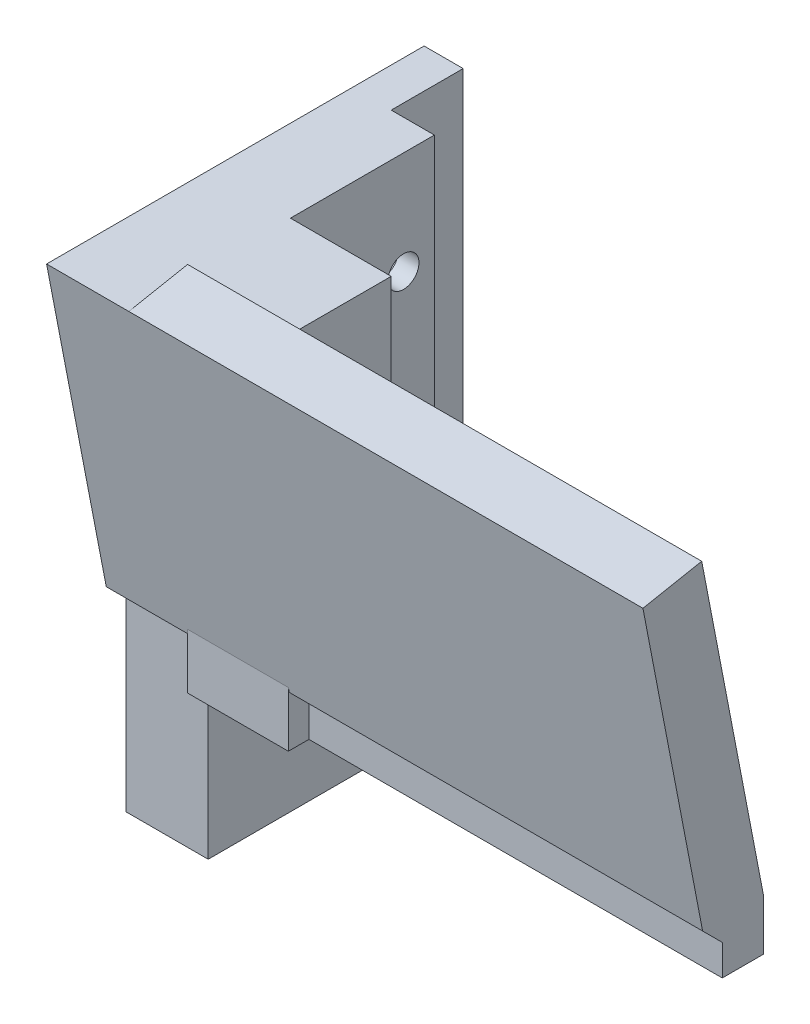
from build123d import *

# Parameters (mm, degrees)
EXTRUDE_1_DEPTH      = 50
SKETCH_2_W           = 50
SKETCH_2_H           = 10
EXTRUDE_2_DEPTH      = 10
SKETCH_3_W           = 10
SKETCH_3_H           = 20
EXTRUDE_3_DEPTH      = 20
SKETCH_4_W           = 20
SKETCH_4_H           = 10
EXTRUDE_4_DEPTH      = 30
CUT_EXTRUDE_1_DEPTH  = 50
CHAMFER_1_SIZE       = 2
SKETCH_9_R           = 1.5
CUT_EXTRUDE_2_DEPTH  = 66.493778942
CUT_EXTRUDE_4_DEPTH  = 6
SKETCH_13_W          = 4
SKETCH_13_H          = 6
EXTRUDE_12_DEPTH     = 18
SKETCH_14_W          = 20
SKETCH_14_H          = 20
EXTRUDE_13_DEPTH     = 6
CUT_EXTRUDE_START    = -20
SKETCH_15_W          = 50
SKETCH_15_H          = 6
CUT_EXTRUDE_5_DEPTH  = 20
SKETCH_16_W          = 4
SKETCH_16_H          = 4
CUT_EXTRUDE_7_DEPTH  = 18
EXTRUDE_14_REACH     = 68.163
SKETCH_17_W          = 5
SKETCH_17_H          = 30
SKETCH_18_W          = 50
SKETCH_18_H          = 4
EXTRUDE_15_DEPTH     = 18
CUT_EXTRUDE_8_REACH  = 67.494
SKETCH_19_W          = 60
SKETCH_19_H          = 10
SKETCH_20_R          = 1.5
CUT_EXTRUDE_9_DEPTH  = 4
CHAMFER_2_SIZE       = 2
SKETCH_21_W          = 15
SKETCH_21_H          = 50
CUT_EXTRUDE_10_DEPTH = 10
SKETCH_22_W          = 5
SKETCH_22_H          = 50
EXTRUDE_16_DEPTH     = 19
SKETCH_23_W          = 7
SKETCH_23_H          = 50
CUT_EXTRUDE_11_DEPTH = 4.2
EXTRUDE_17_DEPTH     = 3
SKETCH_25_R          = 1.5
CUT_EXTRUDE_12_DEPTH = 8
SKETCH_26_R          = 2.9
CUT_EXTRUDE_13_DEPTH = 6
CUT_EXTRUDE_14_REACH = 67.988
SKETCH_27_W          = 4
SKETCH_27_H          = 10
SKETCH_29_W          = 8
SKETCH_29_H          = 10
EXTRUDE_18_DEPTH     = 6
SKETCH_30_W          = 50
SKETCH_30_H          = 5
CUT_EXTRUDE_15_DEPTH = 4
EXTRUDE_19_REACH     = 75.219
SKETCH_31_W          = 9.8
SKETCH_31_H          = 10


with BuildPart() as part:
    # 草图1 → 凸台-拉伸1 (new body)
    with BuildSketch(Plane(origin=(0, 0, 0), x_dir=(0, 0, -1), z_dir=(1, 0, 0))):
        Polygon((0, 0), (-10, 0), (-17.716362436, 40), (-12, 41.102738109), (-6, 10), (0, 10), align=None)
    extrude(amount=EXTRUDE_1_DEPTH)

    # 草图2 → 凸台-拉伸2 (add)
    with BuildSketch(Plane.XZ):
        with Locations((25, 5)):
            Rectangle(SKETCH_2_W, SKETCH_2_H)
    extrude(amount=EXTRUDE_2_DEPTH)

    # 草图3 → 凸台-拉伸3 (add)
    with BuildSketch(Plane.ZY):
        with Locations((5, 0)):
            Rectangle(SKETCH_3_W, SKETCH_3_H)
    extrude(amount=EXTRUDE_3_DEPTH)

    # 草图4 → 凸台-拉伸4 (add)
    with BuildSketch(Plane(origin=(0, 10, 0), x_dir=(1, 0, 0), z_dir=(0, 1, 0))):
        with Locations((-10, -5)):
            Rectangle(SKETCH_4_W, SKETCH_4_H)
    extrude(amount=EXTRUDE_4_DEPTH)

    # 草图5 → 切除-拉伸1 (cut)
    with BuildSketch(Plane(origin=(50, 0, 0), x_dir=(0, 0, -1), z_dir=(1, 0, 0))):
        Polygon((-10, 10), (-11.929090609, 10), (-10, 0), align=None)
    extrude(amount=-CUT_EXTRUDE_1_DEPTH, mode=Mode.SUBTRACT)

    # 倒角1
    # the kernel refuses this chamfer: 2 mm, written as the material it adds along each edge
    with BuildSketch(Plane(origin=(50, 10, 10), x_dir=(0, 0.027495876610586487, 0.9996219169112968), z_dir=(-1, 0, 0))) as chamfer_1_piece_1_section:
        Polygon((CHAMFER_1_SIZE * 0.999621916911, -CHAMFER_1_SIZE * 0.0274958766106), (-CHAMFER_1_SIZE * 0.0274958766106, -CHAMFER_1_SIZE * 0.999621916911), (0, 0), align=None)
    chamfer_1_piece_1 = extrude(amount=50, mode=Mode.PRIVATE)
    chamfer_1_piece_1 = split(chamfer_1_piece_1, bisect_by=Plane(origin=(25, 9.122791872, 11.759869213), z_dir=(0, 0.18941678522713282, -0.9818967774029093)), keep=Keep.TOP, mode=Mode.PRIVATE)
    add(chamfer_1_piece_1)

    # 草图9 → 切除-拉伸2 (cut, through all)
    with BuildSketch(Plane.XY.offset(10)):
        with Locations((-10, 30)):
            Circle(SKETCH_9_R)
        with Locations((30, 0)):
            Circle(SKETCH_9_R)
    extrude(amount=-CUT_EXTRUDE_2_DEPTH, mode=Mode.SUBTRACT)

    # 草图12 → 切除-拉伸4 (cut)
    with BuildSketch(Plane.XY.offset(10)):
        Polygon((0, 30.73515874), (0, 40), (-20, 40), (-20, -10), (50, -10), (50, 8), (0, 8), align=None)
    extrude(amount=-CUT_EXTRUDE_4_DEPTH, mode=Mode.SUBTRACT)

    # 草图13 → 凸台-拉伸12 (add)
    with BuildSketch(Plane.XZ.offset(-8)):
        with Locations((2, 7)):
            Rectangle(SKETCH_13_W, SKETCH_13_H)
        with Locations((48, 7)):
            Rectangle(SKETCH_13_W, SKETCH_13_H)
    extrude(amount=EXTRUDE_12_DEPTH)

    # 草图14 → 凸台-拉伸13 (add)
    with BuildSketch(Plane.XY.offset(4)):
        with Locations((-10, 0)):
            Rectangle(SKETCH_14_W, SKETCH_14_H)
    extrude(amount=EXTRUDE_13_DEPTH)

    # 草图15 → 切除-拉伸5 (cut)
    with BuildSketch(Plane(origin=(0, 10, 0), x_dir=(1, 0, 0), z_dir=(0, 1, 0)).offset(CUT_EXTRUDE_START)):
        with Locations((25, -3)):
            Rectangle(SKETCH_15_W, SKETCH_15_H)
    extrude(amount=CUT_EXTRUDE_5_DEPTH, mode=Mode.SUBTRACT)

    # 草图16 → 切除-拉伸7 (cut)
    with BuildSketch(Plane.XZ.offset(10)):
        with Locations((2, 8)):
            Rectangle(SKETCH_16_W, SKETCH_16_H)
        with Locations((48, 8)):
            Rectangle(SKETCH_16_W, SKETCH_16_H)
    extrude(amount=-CUT_EXTRUDE_7_DEPTH, mode=Mode.SUBTRACT)

    # 凸台-拉伸14: up to this plane
    extrude_14_end = Plane(origin=(50, 0, 10), z_dir=(0, 0.1894167852271328, -0.9818967774029093))
    # 草图17 → 凸台-拉伸14 (add, up to the surface)
    with BuildSketch(Plane.XY.offset(4), mode=Mode.PRIVATE) as extrude_14_sk1:
        with Locations((-2.5, 25)):
            Rectangle(SKETCH_17_W, SKETCH_17_H)
    extrude_14_tool1 = split(extrude(extrude_14_sk1.sketch, amount=EXTRUDE_14_REACH, mode=Mode.PRIVATE), bisect_by=extrude_14_end, keep=Keep.BOTH, mode=Mode.PRIVATE)
    add(extrude_14_tool1.solids().sort_by_distance((-2.5, 25, 4))[0])

    # 草图18 → 凸台-拉伸15 (add)
    with BuildSketch(Plane.XZ.offset(-8)):
        with Locations((25, 8)):
            Rectangle(SKETCH_18_W, SKETCH_18_H)
    extrude(amount=EXTRUDE_15_DEPTH)

    # 切除-拉伸8: up to this face of the body (flat: up to its plane)
    cut_extrude_8_end = Plane(part.part.faces().sort_by_distance((-12.539896603, 24.920206795, 4))[0])
    # 草图19 → 切除-拉伸8 (cut, up to the picked face)
    with BuildSketch(Plane.XY.offset(10), mode=Mode.PRIVATE) as cut_extrude_8_sk1:
        with Locations((10, 0)):
            Rectangle(SKETCH_19_W, SKETCH_19_H)
    cut_extrude_8_tool1 = split(extrude(cut_extrude_8_sk1.sketch, amount=-CUT_EXTRUDE_8_REACH, mode=Mode.PRIVATE), bisect_by=cut_extrude_8_end, keep=Keep.BOTH, mode=Mode.PRIVATE)
    add(cut_extrude_8_tool1.solids().sort_by(Axis((10, 0, 10), (0, 0, -1)))[0], mode=Mode.SUBTRACT)

    # 草图20 → 切除-拉伸9 (cut)
    with BuildSketch(Plane.XY.offset(4)):
        with Locations((-10, 0)):
            Circle(SKETCH_20_R)
    extrude(amount=-CUT_EXTRUDE_9_DEPTH, mode=Mode.SUBTRACT)

    # 倒角2
    # the kernel refuses this chamfer: 2 mm, written as the material it adds along each edge
    with BuildSketch(Plane(origin=(5.143365976, 10, 10), x_dir=(0, -0.9996219169112968, -0.027495876610586487), z_dir=(-1, 0, 0))) as chamfer_2_piece_1_section:
        Polygon((CHAMFER_2_SIZE * 0.999621916911, CHAMFER_2_SIZE * 0.0274958766106), (-CHAMFER_2_SIZE * 0.0274958766106, CHAMFER_2_SIZE * 0.999621916911), (0, 0), align=None)
    chamfer_2_piece_1 = extrude(amount=10.143365976, mode=Mode.PRIVATE)
    chamfer_2_piece_1 = split(chamfer_2_piece_1, bisect_by=Plane(origin=(-2.5, 9.121127045, 11.759548053), z_dir=(0, 0.18941678522698793, -0.9818967774029372)), keep=Keep.TOP, mode=Mode.PRIVATE)
    add(chamfer_2_piece_1)

    # 草图21 → 切除-拉伸10 (cut)
    with BuildSketch(Plane.XY.offset(10)):
        with Locations((-12.5, 15)):
            Rectangle(SKETCH_21_W, SKETCH_21_H)
    extrude(amount=-CUT_EXTRUDE_10_DEPTH, mode=Mode.SUBTRACT)

    # 草图22 → 凸台-拉伸16 (add)
    with BuildSketch(Plane(origin=(0, 0, 0), x_dir=(-1, 0, 0), z_dir=(0, 0, -1))):
        with Locations((2.5, 15)):
            Rectangle(SKETCH_22_W, SKETCH_22_H)
    extrude(amount=EXTRUDE_16_DEPTH)

    # 草图23 → 切除-拉伸11 (cut)
    with BuildSketch(Plane(origin=(0, 0, 0), x_dir=(0, 0, -1), z_dir=(1, 0, 0))):
        with Locations((15.5, 15)):
            Rectangle(SKETCH_23_W, SKETCH_23_H)
    extrude(amount=-CUT_EXTRUDE_11_DEPTH, mode=Mode.SUBTRACT)

    # 草图24 → 凸台-拉伸17 (add)
    with BuildSketch(Plane.ZY.offset(5)):
        Polygon((17.716362436, 40), (-19, 40), (-19, -10), (10, -10), (10, -5), (4, -5), (4, 5), (10, 5), (10, 8), (11.912142006, 9.912142006), align=None)
    extrude(amount=EXTRUDE_17_DEPTH)

    # 草图25 → 切除-拉伸12 (cut)
    with BuildSketch(Plane.ZY.offset(8)):
        with Locations(Location((-9, 30, 0), (0, 0, 270))):
            Circle(SKETCH_25_R)
        with Locations(Location((-9, 0, 0), (0, 0, 270))):
            Circle(SKETCH_25_R)
    extrude(amount=-CUT_EXTRUDE_12_DEPTH, mode=Mode.SUBTRACT)

    # 草图26 → 切除-拉伸13 (cut)
    with BuildSketch(Plane.ZY.offset(8)):
        with Locations(Location((-9, 30, 0), (0, 0, 270))):
            Circle(SKETCH_26_R)
        with Locations(Location((-9, 0, 0), (0, 0, 270))):
            Circle(SKETCH_26_R)
    extrude(amount=-CUT_EXTRUDE_13_DEPTH, mode=Mode.SUBTRACT)

    # 草图27 → 切除-拉伸14 (cut, up to next)
    with BuildSketch(Plane.ZY.offset(-40), mode=Mode.PRIVATE) as cut_extrude_14_sk1:
        with Locations((8, 0)):
            Rectangle(SKETCH_27_W, SKETCH_27_H)
    cut_extrude_14_tool1 = extrude(cut_extrude_14_sk1.sketch, amount=-CUT_EXTRUDE_14_REACH, mode=Mode.PRIVATE) & part.part
    add(cut_extrude_14_tool1.solids().sort_by_distance((40, 0, 8))[0], mode=Mode.SUBTRACT)

    # 草图29 → 凸台-拉伸18 (add)
    with BuildSketch(Plane.XY.offset(4)):
        with Locations((-4, 0)):
            Rectangle(SKETCH_29_W, SKETCH_29_H)
    extrude(amount=EXTRUDE_18_DEPTH)

    # 草图30 → 切除-拉伸15 (cut)
    with BuildSketch(Plane.XY.offset(10)):
        with Locations((25, -7.5)):
            Rectangle(SKETCH_30_W, SKETCH_30_H)
    extrude(amount=-CUT_EXTRUDE_15_DEPTH, mode=Mode.SUBTRACT)

    # 凸台-拉伸19: up to this face of the body (flat: up to its plane)
    extrude_19_end = Plane(part.part.faces().sort_by_distance((25, 5, 8))[0])
    # 草图31 → 凸台-拉伸19 (add, up to the picked face)
    with BuildSketch(Plane(origin=(0, 40, 0), x_dir=(1, 0, 0), z_dir=(0, 1, 0)), mode=Mode.PRIVATE) as extrude_19_sk1:
        with Locations((4.9, -7)):
            Rectangle(SKETCH_31_W, SKETCH_31_H)
    extrude_19_tool1 = split(extrude(extrude_19_sk1.sketch, amount=-EXTRUDE_19_REACH, mode=Mode.PRIVATE), bisect_by=extrude_19_end, keep=Keep.BOTH, mode=Mode.PRIVATE)
    add(extrude_19_tool1.solids().sort_by(Axis((4.9, 40, 7), (0, -1, 0)))[0])


solid = part.part
